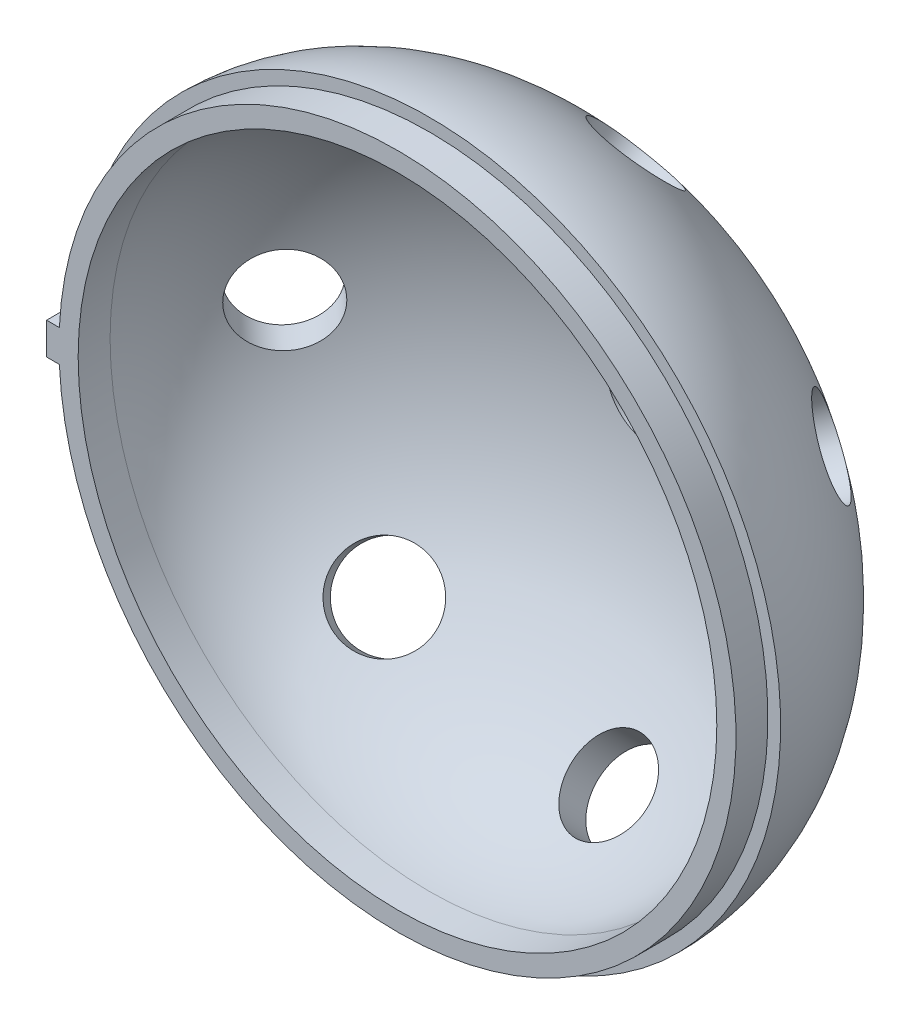
from build123d import *

# Parameters (mm, degrees)
SKETCH_2_R                = 2.75
CUT_EXTRUDE_2_DEPTH       = 35.985711541
PATTERN_START             = -20
PATTERN_CURVE_1_OUTLINE_R = 2.75
PATTERN_CURVE_1_DEPTH     = 4
PATTERN_CIRCULAR_28_COUNT = 7
SKETCH_24_R               = 20
EXTRUDE_7_DEPTH           = 2


with BuildPart() as part:
    # 草图1 → 旋转1 (revolve)
    with BuildSketch(Plane(origin=(0, 0, 0), x_dir=(1, 0, 0), z_dir=(0, 1, 0))):
        with BuildLine():
            Line((-22, 0), (-20, 0))
            add(Edge.make_bspline(
                [(0, 14), (-20, 14), (-20, 0)],
                knots=[1.570796327, 1.570796327, 1.570796327, 3.141592654, 3.141592654, 3.141592654], degree=2, weights=[1, 0.707106781, 1]))
            Line((0, 14), (0, 16))
            add(Edge.make_bspline(
                [(0, 16), (-22, 16), (-22, 0)],
                knots=[1.570796327, 1.570796327, 1.570796327, 3.141592654, 3.141592654, 3.141592654], degree=2, weights=[1, 0.707106781, 1]))
        make_face()
    revolve(axis=Axis((0, 0, -16), (0, 0, 1)))

    # 草图2 → 切除-拉伸2 (cut, through all)
    with BuildSketch(Plane.XY):
        with Locations(Location((0, 0, 0), (0, 0, 180))):
            Circle(SKETCH_2_R)
    extrude(amount=-CUT_EXTRUDE_2_DEPTH, mode=Mode.SUBTRACT)

    # 曲线阵列1: read off the stored shape, not the designer's step
    # 曲线阵列1 outline → 曲线阵列1 (cut)
    with BuildSketch(Plane(origin=(0, 0, 0), x_dir=(0.6840359338597551, 0, -0.7294483128972282), z_dir=(0.7294483128972282, 0, 0.6840359338597553)).offset(PATTERN_START)):
        with Locations((-5.856723788, 0)):
            Circle(PATTERN_CURVE_1_OUTLINE_R)
    pattern_curve_1 = extrude(amount=PATTERN_CURVE_1_DEPTH, mode=Mode.SUBTRACT)

    # 阵列(圆周)28: 曲线阵列1 ×7 about axis
    pattern_circular_28_axis = Axis((0, 0, -21.563563878), (0, 0, 1))
    for i in range(1, PATTERN_CIRCULAR_28_COUNT):
        add(pattern_curve_1.rotate(pattern_circular_28_axis, i * 360 / PATTERN_CIRCULAR_28_COUNT), mode=Mode.SUBTRACT)

    # 草图24 → 凸台-拉伸7 (add)
    with BuildSketch(Plane.XY):
        with BuildLine():
            Line((-21.977260976, 1), (-21.176401961, 1))
            ThreePointArc((-21.176401961, 1), (21.2, 0), (-21.176401961, -1))
            Line((-21.176401961, -1), (-21.977260976, -1))
            ThreePointArc((-21.977260976, -1), (-22, 0), (-21.977260976, 1))
        make_face()
        with Locations(Location((0, 0, 0), (0, 0, 180))):
            Circle(SKETCH_24_R, mode=Mode.SUBTRACT)
    extrude(amount=EXTRUDE_7_DEPTH)


solid = part.part
